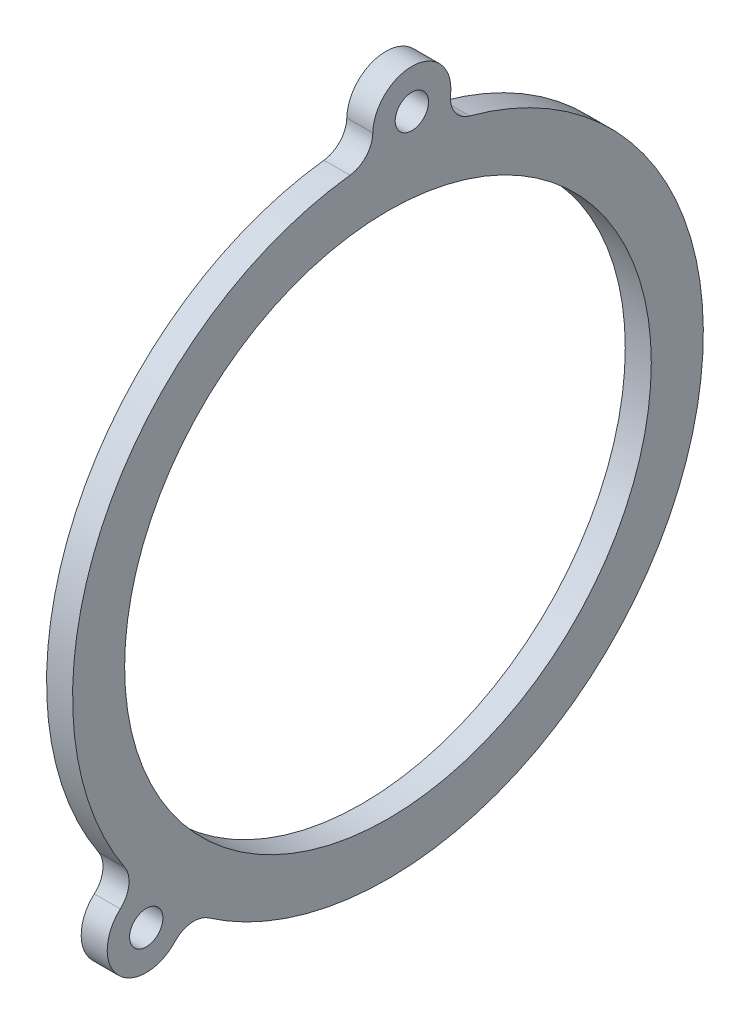
from build123d import *

# Parameters (mm, degrees)
SKETCH1_R           = 32.131
SKETCH1_R_2         = 2.032
BOSS_EXTRUDE1_DEPTH = 3.175
FILLET1_R           = 3.175


with BuildPart() as part:
    # Sketch1 → Boss-Extrude1 (new body)
    with BuildSketch(Plane(origin=(0, 0, 0), x_dir=(0, 0, -1), z_dir=(1, 0, 0))):
        with BuildLine():
            ThreePointArc((-1.005599631, 38.467858407), (-34.9239811, 16.158678942), (-29.971033945, -24.135544022))
            ThreePointArc((-29.971033945, -24.135544022), (-32.897435305, -32.20574726), (-24.766877767, -29.451470704))
            ThreePointArc((-24.766877767, -29.451470704), (34.9239811, -16.158678942), (6.415069447, 37.942512371))
            ThreePointArc((6.415069447, 37.942512371), (3.251086454, 45.922563551), (-1.005599631, 38.467858407))
        make_face()
        Circle(SKETCH1_R, mode=Mode.SUBTRACT)
        with Locations((2.914767166, 41.171953529)):
            Circle(SKETCH1_R_2, mode=Mode.SUBTRACT)
        with Locations((-29.494252343, -28.874118233)):
            Circle(SKETCH1_R_2, mode=Mode.SUBTRACT)
    extrude(amount=BOSS_EXTRUDE1_DEPTH)

    # Fillet1
    fillet1_edges = [part.edges().sort_by_distance(p)[0] for p in [
        (1.5875, -29.451470704, 24.766877767),
        (1.5875, -24.135544022, 29.971033945),
        (1.5875, 37.942512371, -6.415069447),
        (1.5875, 38.467858407, 1.005599631),
    ]]
    fillet(fillet1_edges, radius=FILLET1_R)


solid = part.part
